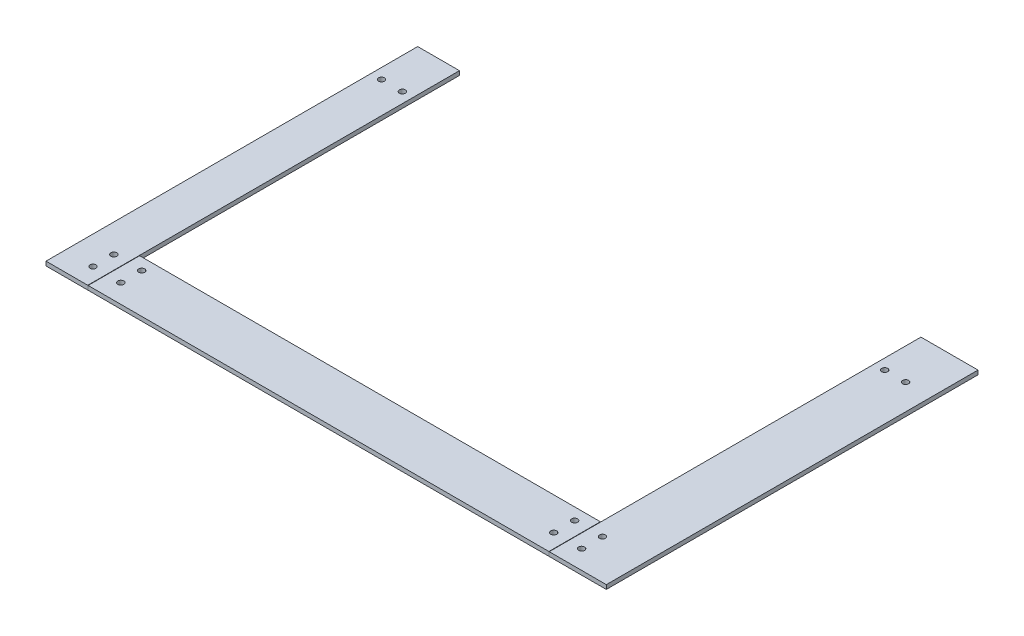
from build123d import *

# Parameters (mm, degrees)
SKETCH1_W                     = 41
SKETCH1_H                     = 267
BOSS_EXTRUDE1_DEPTH           = 3
SKETCH2_W                     = 30
SKETCH2_H                     = 267
BOSS_EXTRUDE2_DEPTH           = 3
SKETCH3_W                     = 331
SKETCH3_H                     = 37
BOSS_EXTRUDE3_DEPTH           = 3
SKETCH6_W                     = 2.15
SKETCH6_H                     = 3
M4_CLEARANCE_HOLE1_AT_2_COUNT = 2
M4_CLEARANCE_HOLE1_AT_2_PITCH = 25
M4_CLEARANCE_HOLE1_AT_3_COUNT = 2
M4_CLEARANCE_HOLE1_AT_3_PITCH = 20
M4_CLEARANCE_HOLE1_AT_4_COUNT = 2
M4_CLEARANCE_HOLE1_AT_4_PITCH = 15
M4_CLEARANCE_HOLE1_AT_5_COUNT = 2
M4_CLEARANCE_HOLE1_AT_5_PITCH = 207.599524325
M4_CLEARANCE_HOLE1_AT_6_COUNT = 2
M4_CLEARANCE_HOLE1_AT_6_PITCH = 205.767010232
MIRROR1_COPY_1_SKETCH_W       = 2.15
MIRROR1_COPY_1_SKETCH_H       = 3
MIRROR1_COPY_2_SKETCH_W       = 2.15
MIRROR1_COPY_2_SKETCH_H       = 3
MIRROR1_COPY_3_SKETCH_W       = 2.15
MIRROR1_COPY_3_SKETCH_H       = 3
MIRROR1_COPY_4_SKETCH_W       = 2.15
MIRROR1_COPY_4_SKETCH_H       = 3
MIRROR1_COPY_5_SKETCH_W       = 2.15
MIRROR1_COPY_5_SKETCH_H       = 3


with BuildPart() as part:
    # Sketch1 → Boss-Extrude1 (new body)
    with BuildSketch(Plane(origin=(0, 0, 0), x_dir=(1, 0, 0), z_dir=(0, 1, 0))):
        with Locations((186.25, -2)):
            Rectangle(SKETCH1_W, SKETCH1_H)
    extrude(amount=BOSS_EXTRUDE1_DEPTH)

    # Mirror1 copy 1 sketch → Mirror1 copy 1 (revolve, cut)
    with BuildSketch(Plane(origin=(175.5, 3, 122), x_dir=(0, 0, 1), z_dir=(-1, 0, 0))):
        with Locations((1.075, -1.5)):
            Rectangle(MIRROR1_COPY_1_SKETCH_W, MIRROR1_COPY_1_SKETCH_H)
    revolve(axis=Axis((175.5, 9.35, 122), (0, 1, 0)), mode=Mode.SUBTRACT)

    # Mirror1 copy 2 sketch → Mirror1 copy 2 (revolve, cut)
    with BuildSketch(Plane(origin=(175.5, 3, 107), x_dir=(0, 0, 1), z_dir=(-1, 0, 0))):
        with Locations((1.075, -1.5)):
            Rectangle(MIRROR1_COPY_2_SKETCH_W, MIRROR1_COPY_2_SKETCH_H)
    revolve(axis=Axis((175.5, 9.35, 107), (0, 1, 0)), mode=Mode.SUBTRACT)

    # Mirror1 copy 4 sketch → Mirror1 copy 4 (revolve, cut)
    with BuildSketch(Plane(origin=(188.25, 3, -98), x_dir=(0, 0, 1), z_dir=(-1, 0, 0))):
        with Locations((1.075, -1.5)):
            Rectangle(MIRROR1_COPY_4_SKETCH_W, MIRROR1_COPY_4_SKETCH_H)
    revolve(axis=Axis((188.25, 9.35, -98), (0, 1, 0)), mode=Mode.SUBTRACT)

    # Mirror1 copy 5 sketch → Mirror1 copy 5 (revolve, cut)
    with BuildSketch(Plane(origin=(173.25, 3, -98), x_dir=(0, 0, 1), z_dir=(-1, 0, 0))):
        with Locations((1.075, -1.5)):
            Rectangle(MIRROR1_COPY_5_SKETCH_W, MIRROR1_COPY_5_SKETCH_H)
    revolve(axis=Axis((173.25, 9.35, -98), (0, 1, 0)), mode=Mode.SUBTRACT)


with BuildPart() as body_2:
    # Sketch2 → Boss-Extrude2 (new body)
    with BuildSketch(Plane(origin=(0, 0, 0), x_dir=(1, 0, 0), z_dir=(0, 1, 0))):
        with Locations((-180.75, -2)):
            Rectangle(SKETCH2_W, SKETCH2_H)
    extrude(amount=BOSS_EXTRUDE2_DEPTH)


with BuildPart() as body_3:
    # Sketch3 → Boss-Extrude3 (new body)
    with BuildSketch(Plane(origin=(0, 0, 0), x_dir=(1, 0, 0), z_dir=(0, 1, 0))):
        with Locations((0, -117)):
            Rectangle(SKETCH3_W, SKETCH3_H)
    extrude(amount=BOSS_EXTRUDE3_DEPTH)

    # Sketch6 → M4 Clearance Hole1 (revolve, cut)
    with BuildSketch(Plane(origin=(-155.5, 3, 107), x_dir=(0, 0, 1), z_dir=(1, 0, 0))):
        with Locations((1.075, 1.5)):
            Rectangle(SKETCH6_W, SKETCH6_H)
    m4_clearance_hole1 = revolve(axis=Axis((-155.5, 9.35, 107), (0, -1, 0)), mode=Mode.SUBTRACT)

    # M4 Clearance Hole1 at 4: M4 Clearance Hole1 ×2
    with Locations(*[(0, 0, i * M4_CLEARANCE_HOLE1_AT_4_PITCH) for i in range(1, M4_CLEARANCE_HOLE1_AT_4_COUNT)]):
        add(m4_clearance_hole1, mode=Mode.SUBTRACT)

    # Mirror1: M4 Clearance Hole1 across plane
    add(m4_clearance_hole1.mirror(Plane(origin=(0, 0, 0), x_dir=(0, 0, 1), z_dir=(1, 0, 0))), mode=Mode.SUBTRACT)

    # Mirror1 copy 3 sketch → Mirror1 copy 3 (revolve, cut)
    with BuildSketch(Plane(origin=(155.5, 3, 122), x_dir=(0, 0, 1), z_dir=(-1, 0, 0))):
        with Locations((1.075, -1.5)):
            Rectangle(MIRROR1_COPY_3_SKETCH_W, MIRROR1_COPY_3_SKETCH_H)
    revolve(axis=Axis((155.5, 9.35, 122), (0, 1, 0)), mode=Mode.SUBTRACT)


with BuildPart() as body_2_1:
    add(body_2.part)

    # M4 Clearance Hole1 at 2: M4 Clearance Hole1 ×2
    with Locations(*[Vector(-0.8, 0, 0.6) * (i * M4_CLEARANCE_HOLE1_AT_2_PITCH) for i in range(1, M4_CLEARANCE_HOLE1_AT_2_COUNT)]):
        add(m4_clearance_hole1, mode=Mode.SUBTRACT)

    # M4 Clearance Hole1 at 3: M4 Clearance Hole1 ×2
    with Locations(*[(-i * M4_CLEARANCE_HOLE1_AT_3_PITCH, 0, 0) for i in range(1, M4_CLEARANCE_HOLE1_AT_3_COUNT)]):
        add(m4_clearance_hole1, mode=Mode.SUBTRACT)

    # M4 Clearance Hole1 at 5: M4 Clearance Hole1 ×2
    with Locations(*[Vector(-0.15775566011758607, 0, -0.9874781778352699) * (i * M4_CLEARANCE_HOLE1_AT_5_PITCH) for i in range(1, M4_CLEARANCE_HOLE1_AT_5_COUNT)]):
        add(m4_clearance_hole1, mode=Mode.SUBTRACT)

    # M4 Clearance Hole1 at 6: M4 Clearance Hole1 ×2
    with Locations(*[Vector(-0.08626261313681217, 0, -0.996272433411067) * (i * M4_CLEARANCE_HOLE1_AT_6_PITCH) for i in range(1, M4_CLEARANCE_HOLE1_AT_6_COUNT)]):
        add(m4_clearance_hole1, mode=Mode.SUBTRACT)


solid = Compound([part.part, body_3.part, body_2_1.part])
